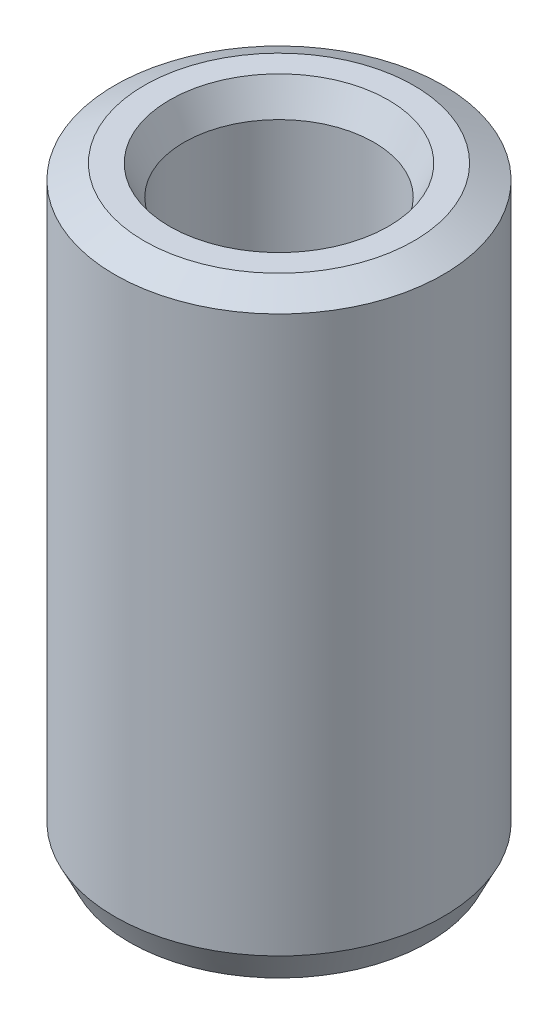
from build123d import *
from OCP.BRepFilletAPI import BRepFilletAPI_MakeChamfer

# Parameters (mm, degrees)
SKETCH1_R           = 45
BOSS_EXTRUDE1_DEPTH = 164.468646223
SKETCH2_R           = 26.032668605
CUT_EXTRUDE1_DEPTH  = 177.351738268
CHAMFER1_SIZE       = 3.983486963
CHAMFER1_SIZE2      = 8.043724292


with BuildPart() as part:
    # Sketch1 → Boss-Extrude1 (new body)
    with BuildSketch(Plane(origin=(0, 0, 0), x_dir=(1, 0, 0), z_dir=(0, 1, 0))):
        Circle(SKETCH1_R)
    extrude(amount=BOSS_EXTRUDE1_DEPTH)

    # Sketch2 → Cut-Extrude1 (cut, through all)
    with BuildSketch(Plane(origin=(0, 0, 0), x_dir=(1, 0, 0), z_dir=(0, 1, 0))):
        Circle(SKETCH2_R)
    extrude(amount=CUT_EXTRUDE1_DEPTH, mode=Mode.SUBTRACT)

    # Chamfer1: one chamfer whose edges measure the first distance from different faces: ONE call of the kernel's chamfer builder (chamfer() names one face for all edges)
    chamfer1_edges_1 = [part.edges().sort_by_distance(p)[0] for p in [
        (-26.032668605, 164.468646223, 0),
    ]]
    chamfer1_side_1 = [part.faces().sort_by_distance(p)[0] for p in [
        (-43.727207794, 164.468646223, 0),
    ]]
    chamfer1_edges_2 = [part.edges().sort_by_distance(p)[0] for p in [
        (-26.032668605, 0, 0),
    ]]
    chamfer1_side_2 = [part.faces().sort_by_distance(p)[0] for p in [
        (-26.032668605, 82.234323111, 0),
    ]]
    chamfer1_edges_3 = [part.edges().sort_by_distance(p)[0] for p in [
        (-45, 0, 0),
    ]]
    chamfer1_side_3 = [part.faces().sort_by_distance(p)[0] for p in [
        (-43.727207794, 0, 0),
    ]]
    chamfer1_edges_4 = [part.edges().sort_by_distance(p)[0] for p in [
        (-45, 164.468646223, 0),
    ]]
    chamfer1_side_4 = [part.faces().sort_by_distance(p)[0] for p in [
        (-45, 82.234323111, 0),
    ]]
    chamfer1 = BRepFilletAPI_MakeChamfer(part.part.solid().wrapped)
    for e in chamfer1_edges_1:
        chamfer1.Add(CHAMFER1_SIZE, CHAMFER1_SIZE2, e.wrapped, chamfer1_side_1[0].wrapped)  # the first distance lies on this face
    for e in chamfer1_edges_2:
        chamfer1.Add(CHAMFER1_SIZE, CHAMFER1_SIZE2, e.wrapped, chamfer1_side_2[0].wrapped)  # the first distance lies on this face
    for e in chamfer1_edges_3:
        chamfer1.Add(CHAMFER1_SIZE, CHAMFER1_SIZE2, e.wrapped, chamfer1_side_3[0].wrapped)  # the first distance lies on this face
    for e in chamfer1_edges_4:
        chamfer1.Add(CHAMFER1_SIZE, CHAMFER1_SIZE2, e.wrapped, chamfer1_side_4[0].wrapped)  # the first distance lies on this face
    add(Compound.cast(chamfer1.Shape()), mode=Mode.REPLACE)


solid = part.part
